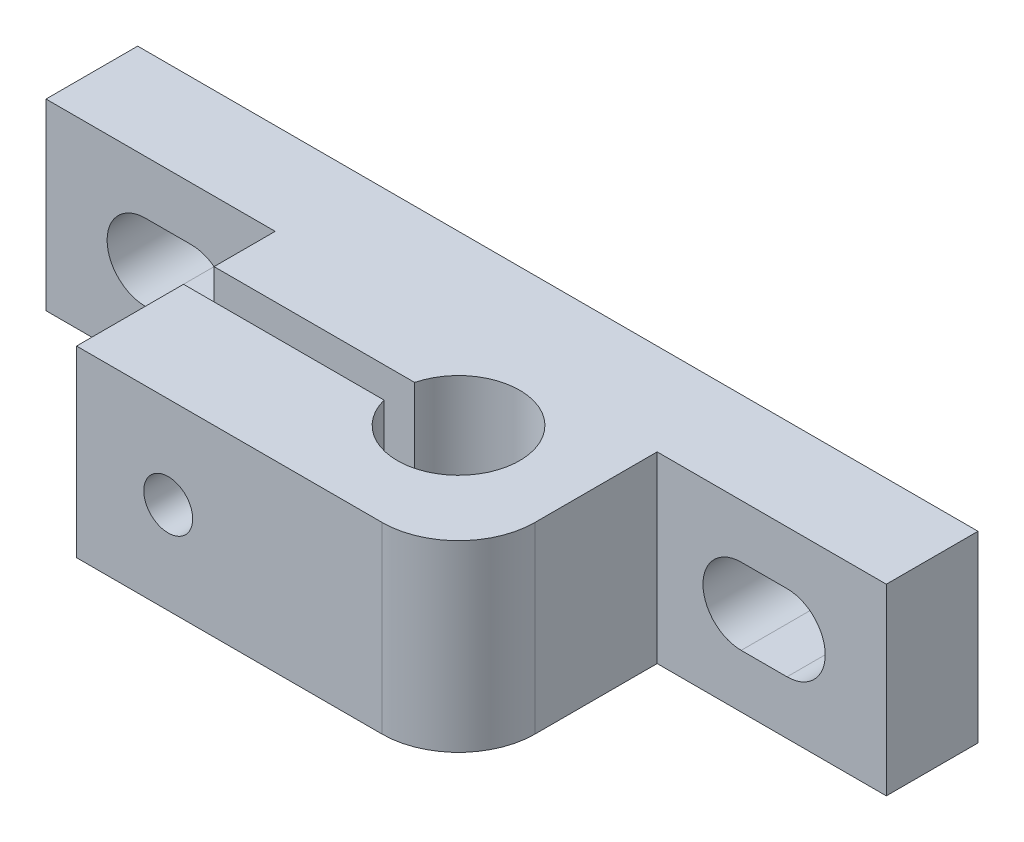
from build123d import *

# Parameters (mm, degrees)
SKETCH2_W           = 55
SKETCH2_H           = 12
BOSS_EXTRUDE1_DEPTH = 6
SKETCH3_W           = 25
SKETCH3_H           = 12
BOSS_EXTRUDE2_DEPTH = 13
FILLET1_R           = 5
CUT_EXTRUDE2_DEPTH  = 30
SKETCH5_W           = 20.513890507
SKETCH5_H           = 7
CUT_EXTRUDE3_DEPTH  = 5
SKETCH6_R           = 1.6
CUT_EXTRUDE4_DEPTH  = 20
CUT_EXTRUDE5_DEPTH  = 3


with BuildPart() as part:
    # Sketch2 → Boss-Extrude1 (new body)
    with BuildSketch(Plane.XY):
        with Locations((27.5, 6)):
            Rectangle(SKETCH2_W, SKETCH2_H)
        with BuildLine():
            Line((6.5, 8.5), (9.5, 8.5))
            ThreePointArc((9.5, 8.5), (12, 6), (9.5, 3.5))
            Line((9.5, 3.5), (6.5, 3.5))
            ThreePointArc((6.5, 3.5), (4, 6), (6.5, 8.5))
        make_face(mode=Mode.SUBTRACT)
        with BuildLine():
            Line((48.5, 8.5), (45.5, 8.5))
            ThreePointArc((45.5, 8.5), (43, 6), (45.5, 3.5))
            Line((45.5, 3.5), (48.5, 3.5))
            ThreePointArc((48.5, 3.5), (51, 6), (48.5, 8.5))
        make_face(mode=Mode.SUBTRACT)
    extrude(amount=BOSS_EXTRUDE1_DEPTH)

    # Sketch3 → Boss-Extrude2 (add)
    with BuildSketch(Plane.XY.offset(6)):
        with Locations((27.5, 6)):
            Rectangle(SKETCH3_W, SKETCH3_H)
    extrude(amount=BOSS_EXTRUDE2_DEPTH)

    # Fillet1
    fillet1_edges = [part.edges().sort_by_distance(p)[0] for p in [
        (40, 6, 19),
    ]]
    fillet(fillet1_edges, radius=FILLET1_R)

    # Sketch4 → Cut-Extrude2 (cut)
    with BuildSketch(Plane.XZ):
        with BuildLine():
            Line((15, 10), (28.127016654, 10))
            ThreePointArc((28.127016654, 10), (36, 11), (28.127016654, 12))
            Line((28.127016654, 12), (15, 12))
            Line((15, 12), (15, 10))
        make_face()
    extrude(amount=-CUT_EXTRUDE2_DEPTH, mode=Mode.SUBTRACT)

    # Sketch5 → Cut-Extrude3 (cut)
    with BuildSketch(Plane(origin=(0, 0, 0), x_dir=(-1, 0, 0), z_dir=(0, 0, -1))):
        with Locations((-27.415473723, 6)):
            Rectangle(SKETCH5_W, SKETCH5_H)
    extrude(amount=-CUT_EXTRUDE3_DEPTH, mode=Mode.SUBTRACT)

    # Sketch6 → Cut-Extrude4 (cut)
    with BuildSketch(Plane.XY.offset(19)):
        with Locations((21, 6)):
            Circle(SKETCH6_R)
    extrude(amount=-CUT_EXTRUDE4_DEPTH, mode=Mode.SUBTRACT)

    # Sketch7 → Cut-Extrude5 (cut)
    with BuildSketch(Plane(origin=(0, 0, 5), x_dir=(-1, 0, 0), z_dir=(0, 0, -1))):
        Polygon((-17.535898385, 6), (-19.267949192, 9), (-22.732050808, 9), (-24.464101615, 6), (-22.732050808, 3), (-19.267949192, 3), align=None)
    extrude(amount=-CUT_EXTRUDE5_DEPTH, mode=Mode.SUBTRACT)


solid = part.part
